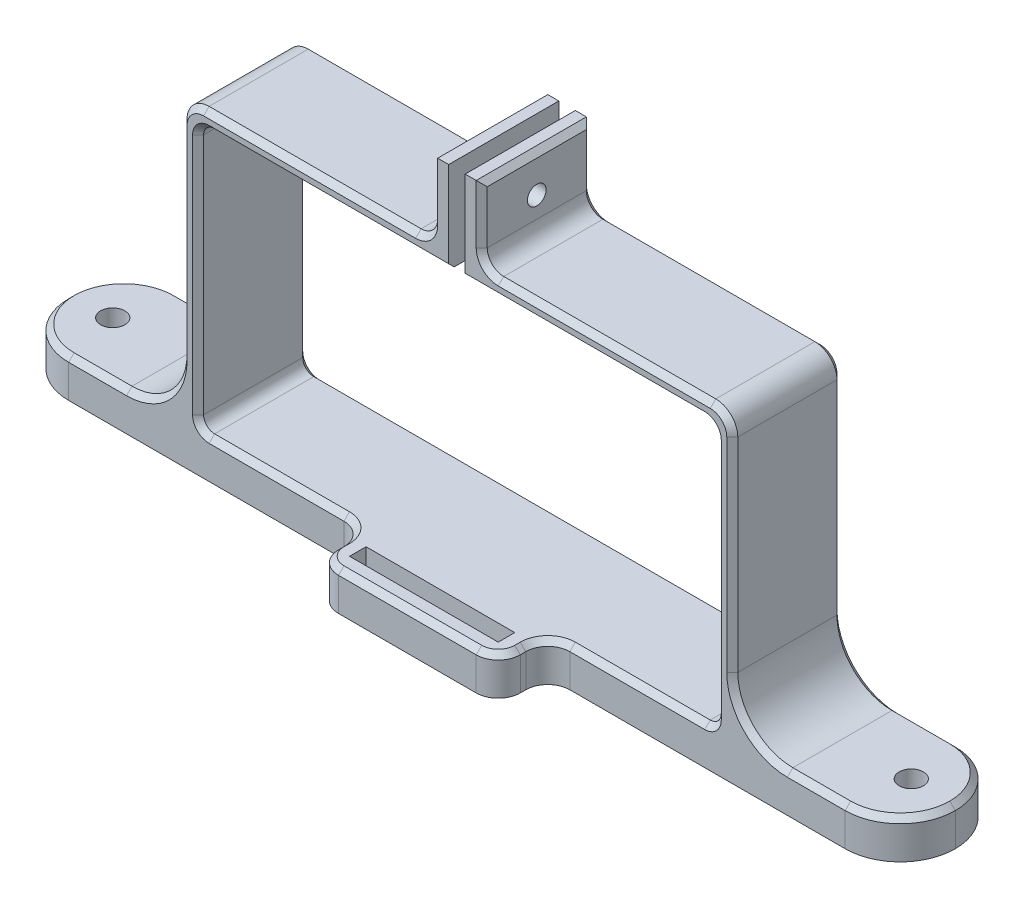
from build123d import *

# Parameters (mm, degrees)
SKETCH1_W           = 161
SKETCH1_H           = 20
SKETCH1_R           = 2.2
BOSS_EXTRUDE1_DEPTH = 7
BOSS_EXTRUDE2_DEPTH = 20
SKETCH4_W           = 33
SKETCH4_H           = 9
SKETCH4_W_2         = 27
SKETCH4_H_2         = 3
BOSS_EXTRUDE3_DEPTH = 7
SKETCH5_R           = 1.7
CUT_EXTRUDE1_DEPTH  = 113.749988914
FILLET1_R           = 2
FILLET2_R           = 10
FILLET3_R           = 3
FILLET4_R           = 4
FILLET5_R           = 4
CHAMFER1_SIZE       = 1


with BuildPart() as part:
    # Sketch1 → Boss-Extrude1 (new body)
    with BuildSketch(Plane(origin=(0, 0, 0), x_dir=(1, 0, 0), z_dir=(0, 1, 0))):
        Rectangle(SKETCH1_W, SKETCH1_H)
        with Locations(Location((-72.5, 0, 0), (0, 0, 270))):
            Circle(SKETCH1_R, mode=Mode.SUBTRACT)
        with Locations(Location((72.5, 0, 0), (0, 0, 270))):
            Circle(SKETCH1_R, mode=Mode.SUBTRACT)
    extrude(amount=BOSS_EXTRUDE1_DEPTH)

    # Sketch2 → Boss-Extrude2 (add)
    with BuildSketch(Plane.XY.offset(10)):
        Polygon((47, 55), (47, 7), (50, 7), (50, 58), (4.5, 58), (4.5, 71.6), (1.5, 71.6), (1.5, 55), align=None)
        Polygon((-50, 58), (-50, 7), (-47, 7), (-47, 55), (-1.5, 55), (-1.5, 71.6), (-4.5, 71.6), (-4.5, 58), align=None)
    extrude(amount=-BOSS_EXTRUDE2_DEPTH)

    # Sketch4 → Boss-Extrude3 (add)
    with BuildSketch(Plane(origin=(0, 0, 0), x_dir=(1, 0, 0), z_dir=(0, 1, 0))):
        with Locations((0, -14.5)):
            Rectangle(SKETCH4_W, SKETCH4_H)
        with Locations((0, -14.5)):
            Rectangle(SKETCH4_W_2, SKETCH4_H_2, mode=Mode.SUBTRACT)
    extrude(amount=BOSS_EXTRUDE3_DEPTH)

    # Sketch5 → Cut-Extrude1 (cut, through all)
    with BuildSketch(Plane.ZY.offset(4.5)):
        with Locations(Location((0, 64.8, 0), (0, 0, 270))):
            Circle(SKETCH5_R)
    extrude(amount=-CUT_EXTRUDE1_DEPTH, mode=Mode.SUBTRACT)

    # Fillet1
    fillet1_edges = [part.edges().sort_by_distance(p)[0] for p in [
        (47, 55, 0),
        (47, 7, 0),
        (-47, 55, 0),
        (-47, 7, 0),
    ]]
    fillet(fillet1_edges, radius=FILLET1_R)

    # Fillet2
    fillet2_edges = [part.edges().sort_by_distance(p)[0] for p in [
        (50, 7, 0),
        (-50, 7, 0),
        (80.5, 3.5, 10),
        (-80.5, 3.5, 10),
        (-80.5, 3.5, -10),
        (80.5, 3.5, -10),
    ]]
    fillet(fillet2_edges, radius=FILLET2_R - 0.0001)  # a hair under: the kernel refuses the full size

    # Fillet3
    fillet3_edges = [part.edges().sort_by_distance(p)[0] for p in [
        (4.5, 58, 0),
        (-4.5, 58, 0),
    ]]
    fillet(fillet3_edges, radius=FILLET3_R)

    # Fillet4
    fillet4_edges = [part.edges().sort_by_distance(p)[0] for p in [
        (-16.5, 3.5, 10),
        (-16.5, 3.5, 19),
        (16.5, 3.5, 19),
        (16.5, 3.5, 10),
    ]]
    fillet(fillet4_edges, radius=FILLET4_R)

    # Fillet5
    fillet5_edges = [part.edges().sort_by_distance(p)[0] for p in [
        (50, 58, 0),
        (-50, 58, 0),
    ]]
    fillet(fillet5_edges, radius=FILLET5_R)

    # Chamfer1
    chamfer1_edges = [part.edges().sort_by_distance(p)[0] for p in [
        (46.414213562, 54.414213562, 10),
        (46.414213562, 54.414213562, -10),
        (46.414213562, 7.585786438, 10),
        (46.414213562, 7.585786438, -10),
        (-46.414213562, 7.585786438, 10),
        (-46.414213562, 7.585786438, -10),
        (-46.414213562, 54.414213562, 10),
        (-46.414213562, 54.414213562, -10),
        (65.25, 7, -10),
        (65.25, 7, 10),
        (77.571097101, 7, -7.071097101),
        (77.571097101, 7, 7.071097101),
        (50, 35.49995, 10),
        (-50, 35.49995, 10),
        (-65.25, 7, -10),
        (-65.25, 7, 10),
        (-77.571097101, 7, 7.071097101),
        (-77.571097101, 7, -7.071097101),
        (52.928902899, 9.928902899, 10),
        (52.928902899, 9.928902899, -10),
        (-52.928902899, 9.928902899, 10),
        (-52.928902899, 9.928902899, -10),
        (26.75, 58, -10),
        (4.5, 66.3, 10),
        (-4.5, 66.3, 10),
        (-26.75, 58, -10),
        (5.378679656, 58.878679656, 10),
        (5.378679656, 58.878679656, -10),
        (-5.378679656, 58.878679656, 10),
        (-5.378679656, 58.878679656, -10),
        (0, 7, 19),
        (-16.5, 7, 14.5),
        (32.75, 7, 10),
        (16.5, 7, 14.5),
        (15.328427125, 7, 17.828427125),
        (-15.328427125, 7, 17.828427125),
        (-17.671572875, 7, 11.171572875),
        (17.671572875, 7, 11.171572875),
        (50, 35.49995, -10),
        (26.75, 58, 10),
        (48.828427125, 56.828427125, 10),
        (-50, 35.49995, -10),
        (-48.828427125, 56.828427125, -10),
        (48.828427125, 56.828427125, -10),
        (-26.75, 58, 10),
        (-48.828427125, 56.828427125, 10),
        (4.5, 71.6, 0),
        (23.25, 55, -10),
        (4.5, 66.3, -10),
        (-4.5, 66.3, -10),
        (-4.5, 71.6, 0),
        (-23.25, 55, -10),
        (23.25, 55, 10),
        (47, 31, -10),
        (47, 31, 10),
        (0, 7, -10),
        (-32.75, 7, 10),
        (-47, 31, -10),
        (-47, 31, 10),
        (-23.25, 55, 10),
    ]]
    chamfer(chamfer1_edges, length=CHAMFER1_SIZE)


solid = part.part
